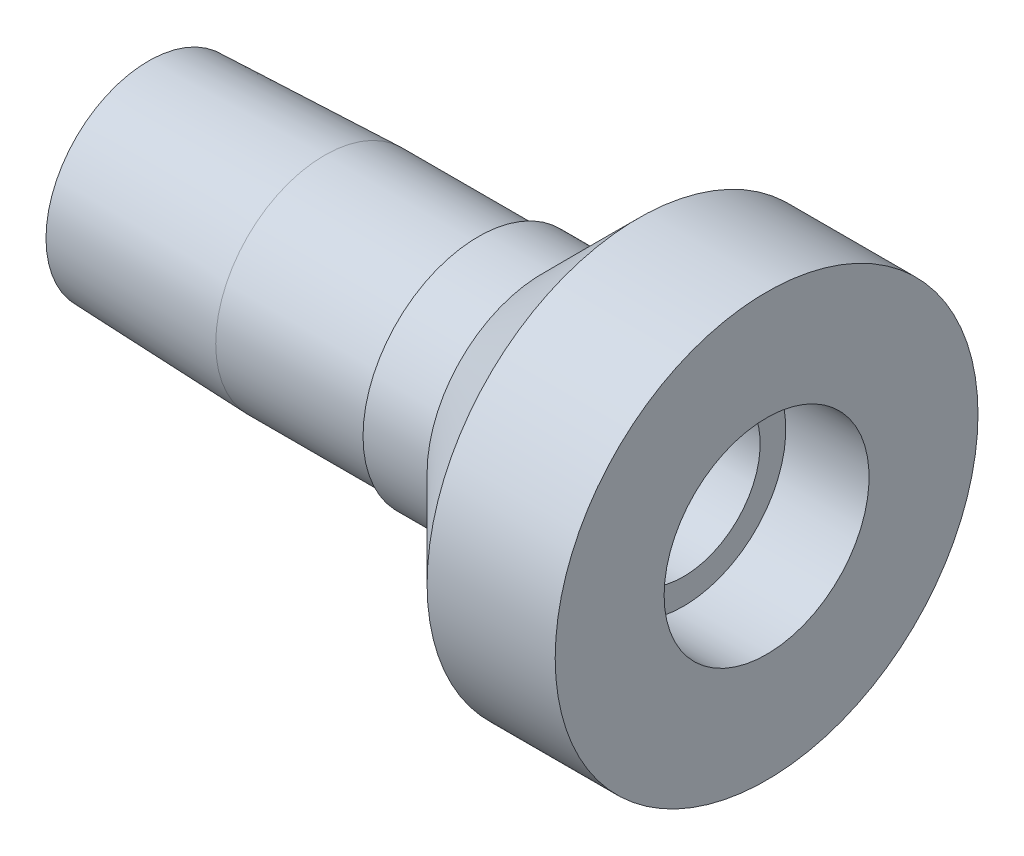
from build123d import *


with BuildPart() as part:
    # Sketch2 → Revolve1 (revolve)
    with BuildSketch(Plane.XY):
        Polygon((0, 8), (0, 6), (41.75, 6), (41.75, 8), (48.25, 8), (48.25, 16.502402586), (38.25, 16.502402586), (30.747597414, 9), (25.747597414, 9), (25.747597414, 8.5), (13.747597414, 8.5), align=None)
    revolve(axis=Axis((0, 0, 0), (1, 0, 0)))


solid = part.part
